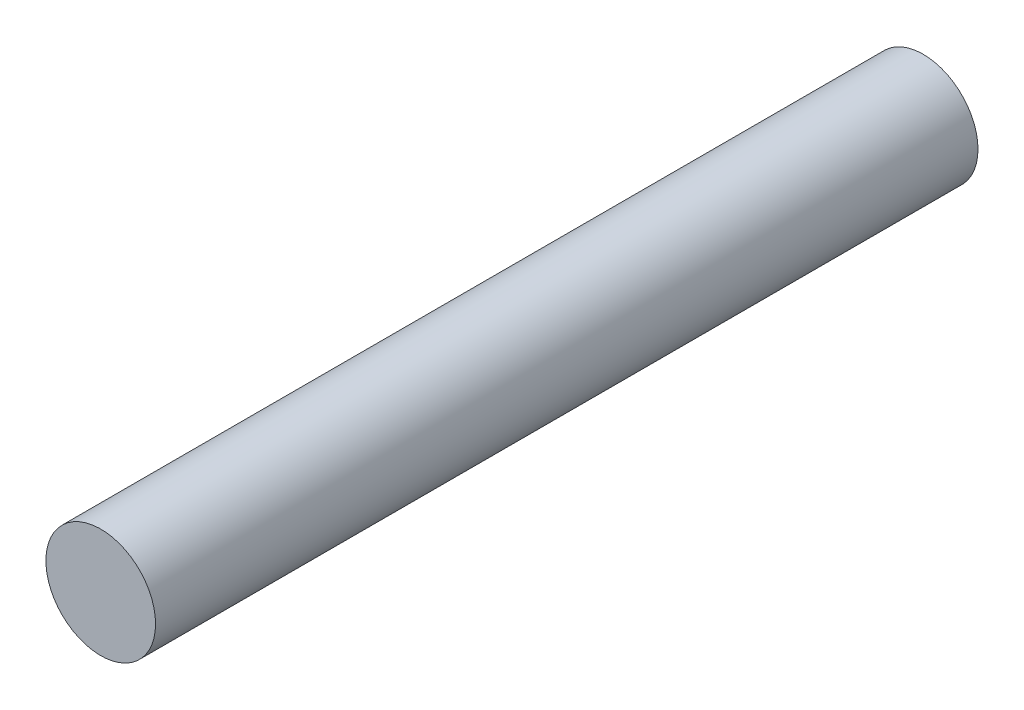
from build123d import *

# Parameters (mm, degrees)
SKETCH1_W = 4
SKETCH1_H = 60


with BuildPart() as part:
    # Sketch1 → Revolve1 (revolve)
    with BuildSketch(Plane(origin=(0, 0, 0), x_dir=(1, 0, 0), z_dir=(0, 1, 0))):
        with Locations((-2, -30)):
            Rectangle(SKETCH1_W, SKETCH1_H)
    revolve(axis=Axis((0, 0, 48.709374581), (0, 0, -1)))


solid = part.part
